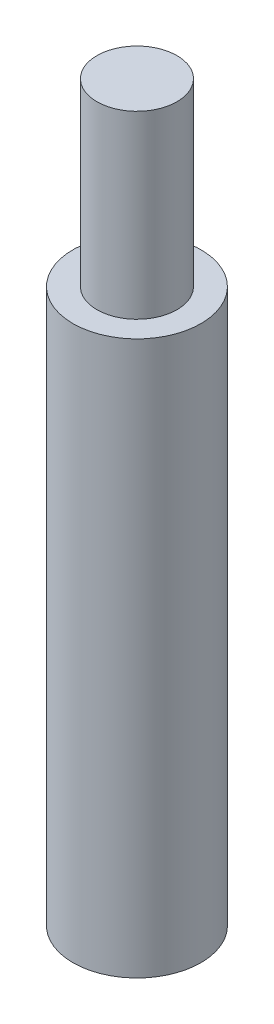
from build123d import *

# Parameters (mm, degrees)
SKETCH1_R           = 5.08
BOSS_EXTRUDE1_DEPTH = 58.24
CUT_EXTRUDE1_START  = -14.3
SKETCH2_R           = 5.08
SKETCH2_R_2         = 3.175
CUT_EXTRUDE1_DEPTH  = 14.3


with BuildPart() as part:
    # Sketch1 → Boss-Extrude1 (new body)
    with BuildSketch(Plane(origin=(0, 0, 0), x_dir=(1, 0, 0), z_dir=(0, 1, 0))):
        Circle(SKETCH1_R)
    extrude(amount=BOSS_EXTRUDE1_DEPTH)

    # Sketch2 → Cut-Extrude1 (cut)
    with BuildSketch(Plane(origin=(0, 58.24, 0), x_dir=(1, 0, 0), z_dir=(0, 1, 0)).offset(CUT_EXTRUDE1_START)):
        Circle(SKETCH2_R)
        Circle(SKETCH2_R_2, mode=Mode.SUBTRACT)
    extrude(amount=CUT_EXTRUDE1_DEPTH, mode=Mode.SUBTRACT)


solid = part.part
